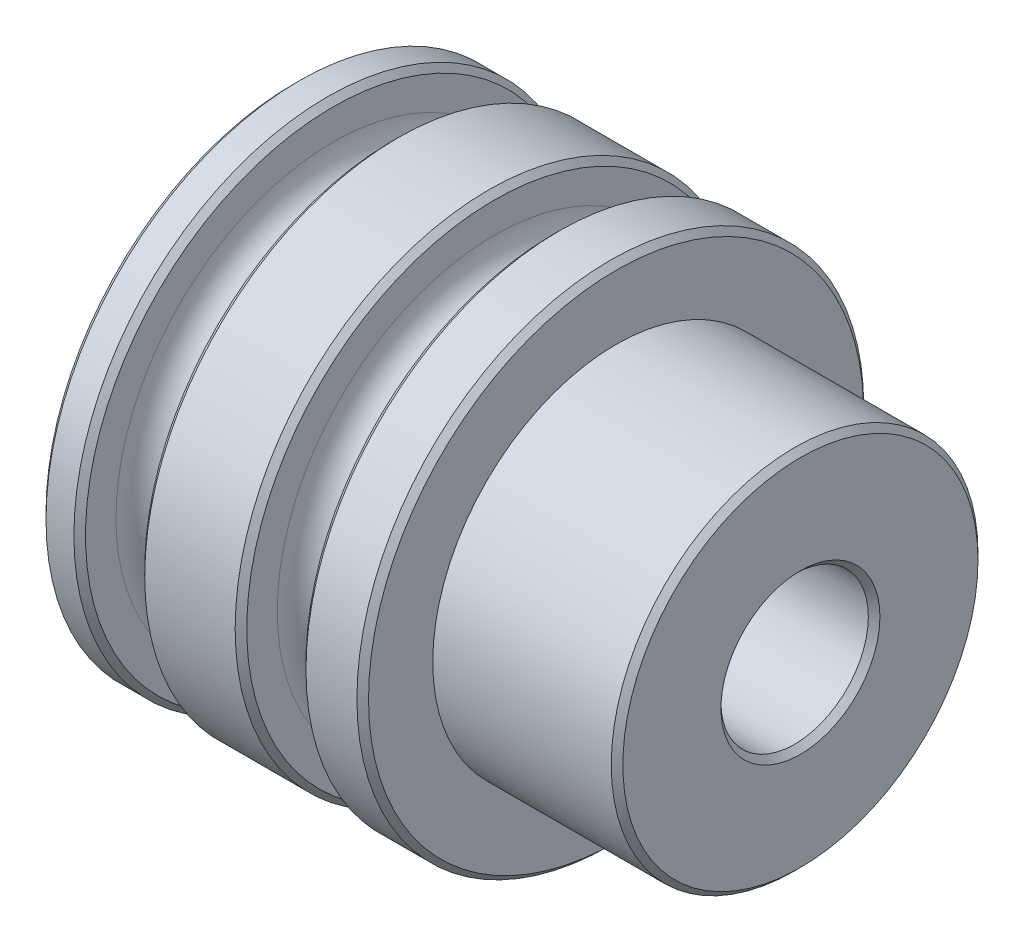
from build123d import *

# Parameters (mm, degrees)
SKETCH1_R           = 12.6365
BOSS_EXTRUDE1_DEPTH = 12.7
SKETCH2_R           = 17.4625
BOSS_EXTRUDE2_DEPTH = 22.225
SKETCH3_R           = 11.1125
CUT_EXTRUDE1_DEPTH  = 7.112
SKETCH4_R           = 7.27458794
CUT_EXTRUDE2_DEPTH  = 0.2
SKETCH5_R           = 5.08
CUT_EXTRUDE3_DEPTH  = 38.045317943
LPATTERN1_COUNT     = 2
LPATTERN1_PITCH     = 11.1125
CHAMFER1_SIZE       = 0.4


with BuildPart() as part:
    # Sketch1 → Boss-Extrude1 (new body)
    with BuildSketch(Plane(origin=(0, 0, 0), x_dir=(0, 0, -1), z_dir=(1, 0, 0))):
        Circle(SKETCH1_R)
    extrude(amount=BOSS_EXTRUDE1_DEPTH)

    # Sketch2 → Boss-Extrude2 (add)
    with BuildSketch(Plane.ZY):
        Circle(SKETCH2_R)
    extrude(amount=BOSS_EXTRUDE2_DEPTH)

    # Sketch3 → Cut-Extrude1 (cut)
    with BuildSketch(Plane.ZY.offset(22.225)):
        Circle(SKETCH3_R)
    extrude(amount=-CUT_EXTRUDE1_DEPTH, mode=Mode.SUBTRACT)

    # Sketch4 → Cut-Extrude2 (cut)
    with BuildSketch(Plane.ZY.offset(15.113)):
        Circle(SKETCH4_R)
    extrude(amount=-CUT_EXTRUDE2_DEPTH, mode=Mode.SUBTRACT)

    # Sketch5 → Cut-Extrude3 (cut, through all)
    with BuildSketch(Plane.ZY.offset(14.913)):
        Circle(SKETCH5_R)
    extrude(amount=-CUT_EXTRUDE3_DEPTH, mode=Mode.SUBTRACT)

    # Sketch6 → Cut-Revolve1 (revolve, cut)
    with BuildSketch(Plane.XY):
        with BuildLine():
            Line((-4.310000016, 17.4625), (-8.389999984, 17.4625))
            Line((-8.389999984, 17.4625), (-8.389999984, 14.96249992))
            ThreePointArc((-8.389999984, 14.96249992), (-6.35, 12.922499936), (-4.310000016, 14.96249992))
            Line((-4.310000016, 14.96249992), (-4.310000016, 17.4625))
        make_face()
    cut_revolve1 = revolve(axis=Axis((-6.35, 0, 0), (1, 0, 0)), mode=Mode.SUBTRACT)

    # LPattern1: Cut-Revolve1 ×2
    with Locations(*[(-i * LPATTERN1_PITCH, 0, 0) for i in range(1, LPATTERN1_COUNT)]):
        add(cut_revolve1, mode=Mode.SUBTRACT)

    # Chamfer1
    chamfer1_edges = [part.edges().sort_by_distance(p)[0] for p in [
        (12.7, 0, 12.6365),
        (12.7, 0, -5.08),
        (-22.225, 0, -17.4625),
        (-22.225, 0, -11.1125),
        (-19.502499984, 0, -17.4625),
        (-8.389999984, 0, -17.4625),
        (-15.422500016, 0, -17.4625),
        (0, 0, -17.4625),
        (-4.310000016, 0, -17.4625),
    ]]
    chamfer(chamfer1_edges, length=CHAMFER1_SIZE)


solid = part.part
